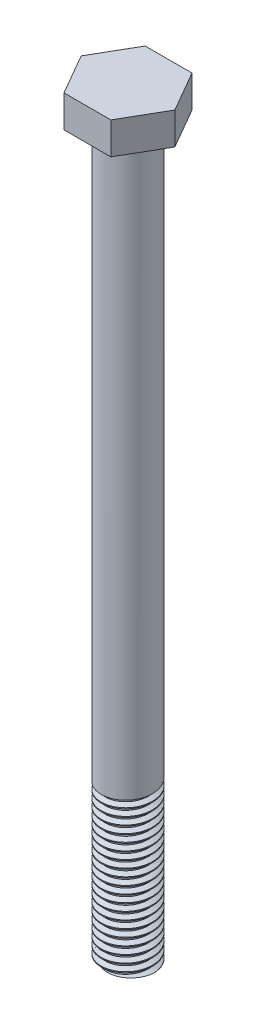
from build123d import *

# Parameters (mm, degrees)
SKETCH1_R           = 6
BOSS_EXTRUDE1_DEPTH = 170
BOSS_EXTRUDE2_DEPTH = 7.5
THREAD1_PITCH       = 1.75


with BuildPart() as part:
    # Sketch1 → Boss-Extrude1 (new body)
    with BuildSketch(Plane(origin=(0, 0, 0), x_dir=(1, 0, 0), z_dir=(0, 1, 0))):
        with Locations(Location((0, 0, 0), (0, 0, 270))):
            Circle(SKETCH1_R)
    extrude(amount=-BOSS_EXTRUDE1_DEPTH)

    # Sketch2 → Boss-Extrude2 (add)
    with BuildSketch(Plane(origin=(0, 0, 0), x_dir=(1, 0, 0), z_dir=(0, 1, 0))):
        Polygon((-5.484827557, -9.5), (5.484827557, -9.5), (10.969655115, 0), (5.484827557, 9.5), (-5.484827557, 9.5), (-10.969655115, 0), align=None)
    extrude(amount=BOSS_EXTRUDE2_DEPTH)

    # Thread1: the profile of Thread Profile1 profile screwed along a right-hand helix of 21.571429 turns, 10 arcs to a turn; built about Z, then put on its axis
    thread1_z = Axis((0, 0, 0), (0, 0, 1))
    thread1_corners = [(6.0003, 0, -0.000173205), (6.0003, 0, 1.5314232), (5.052784719, 0, 0.984374998), (5.052784719, 0, 0.546874998)]
    with BuildLine(mode=Mode.PRIVATE) as thread1_profile:
        Line(thread1_corners[0], thread1_corners[1])
        Line(thread1_corners[1], thread1_corners[2])
        Line(thread1_corners[2], thread1_corners[3])
        Line(thread1_corners[3], thread1_corners[0])
    thread1_cap = Face(thread1_profile.wire())
    thread1_turn_angles = [0, 18, 36, 54, 72, 90, 108, 126, 144, 162, 180, 198, 216, 234, 252, 270, 288, 306, 324, 342, 360]
    thread1_turn_weights = [1, 0.9510565162951535, 1, 0.9510565162951535, 1, 0.9510565162951535, 1, 0.9510565162951535, 1, 0.9510565162951535, 1, 0.9510565162951535, 1, 0.9510565162951535, 1, 0.9510565162951535, 1, 0.9510565162951535, 1, 0.9510565162951535, 1]
    thread1_turn_rails = [Edge.make_bspline([Vector(p[0], p[1], 0).rotate(thread1_z, thread1_turn_angles[k]) / thread1_turn_weights[k] + Vector(0, 0, p[2] + THREAD1_PITCH * thread1_turn_angles[k] / 360) for k in range(21)], [0, 0, 0, 1, 1, 2, 2, 3, 3, 4, 4, 5, 5, 6, 6, 7, 7, 8, 8, 9, 9, 10, 10, 10], 2, thread1_turn_weights) for p in thread1_corners]
    thread1_turn_sides = [Face.make_surface_from_curves(thread1_turn_rails[p[0]], thread1_turn_rails[p[1]]) for p in [(0, 1), (1, 2), (2, 3), (3, 0)]]
    thread1_last_angles = [7560, 7578, 7596, 7614, 7632, 7650, 7668, 7686, 7704, 7722, 7740, 7752.857142857, 7765.714285714]
    thread1_last_weights = [1, 0.9510565162951535, 1, 0.9510565162951535, 1, 0.9510565162951535, 1, 0.9510565162951535, 1, 0.9510565162951535, 1, 0.9749279121818244, 1]
    thread1_last_rails = [Edge.make_bspline([Vector(p[0], p[1], 0).rotate(thread1_z, thread1_last_angles[k]) / thread1_last_weights[k] + Vector(0, 0, p[2] + THREAD1_PITCH * thread1_last_angles[k] / 360) for k in range(13)], [0, 0, 0, 1, 1, 2, 2, 3, 3, 4, 4, 5, 5, 6, 6, 6], 2, thread1_last_weights) for p in thread1_corners]
    thread1_last_sides = [Face.make_surface_from_curves(thread1_last_rails[p[0]], thread1_last_rails[p[1]]) for p in [(0, 1), (1, 2), (2, 3), (3, 0)]]
    thread1 = Plane(origin=(0, -171.75, 0), x_dir=(1, 0, 0), z_dir=(0, 1, 0)) * Solid(Shell([*[p.moved(Location((0, 0, THREAD1_PITCH * i))) for i in range(21) for p in thread1_turn_sides], *thread1_last_sides, thread1_cap, thread1_cap.rotate(thread1_z, 7765.714285714).moved(Location((0, 0, THREAD1_PITCH * 7765.714285714 / 360)))]))
    add(thread1, mode=Mode.SUBTRACT)


solid = part.part
